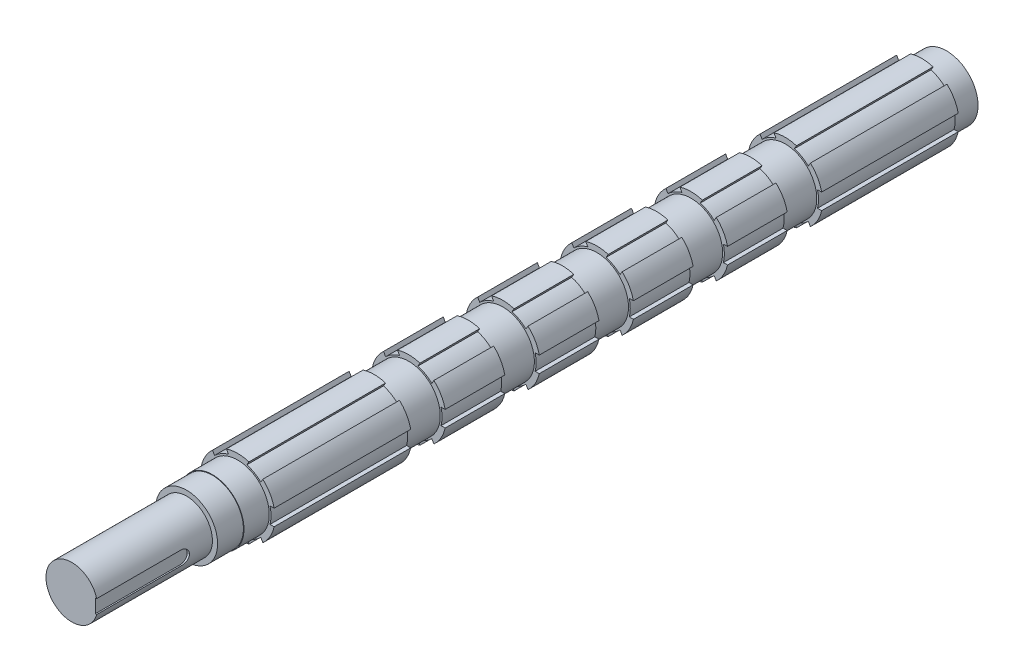
from build123d import *

# Parameters (mm, degrees)
SKETCH1_R           = 32.5
BOSS_EXTRUDE1_DEPTH = 762
SKETCH2_W           = 5
SKETCH2_H           = 30
SKETCH2_H_2         = 21.5
CUT_EXTRUDE1_DEPTH  = 762
CIRPATTERN1_COUNT   = 6
CUT_EXTRUDE2_START  = -80
CUT_EXTRUDE2_DEPTH  = 80
FILLET1_R           = 6


with BuildPart() as part:
    # Sketch1 → Boss-Extrude1 (new body)
    with BuildSketch(Plane.XY):
        Circle(SKETCH1_R)
    extrude(amount=BOSS_EXTRUDE1_DEPTH)

    # Sketch2 → Cut-Revolve1 (revolve, cut)
    with BuildSketch(Plane(origin=(0, 0, 0), x_dir=(1, 0, 0), z_dir=(0, 1, 0)), mode=Mode.PRIVATE) as cut_revolve1_sk:
        Polygon((32.5, -762), (22.5, -762), (22.5, -662), (27, -662), (27, -639.5), (27.5, -639.5), (27.5, -617.5), (32.5, -617.5), (32.5, -639.5), (32.5, -662), align=None)
        with Locations((30, -483.5)):
            Rectangle(SKETCH2_W, SKETCH2_H)
        with Locations((30, -401.5)):
            Rectangle(SKETCH2_W, SKETCH2_H)
        with Locations((30, -319.5)):
            Rectangle(SKETCH2_W, SKETCH2_H)
        with Locations((30, -237.5)):
            Rectangle(SKETCH2_W, SKETCH2_H)
        with Locations((30, -155.5)):
            Rectangle(SKETCH2_W, SKETCH2_H)
        with Locations((30, -10.75)):
            Rectangle(SKETCH2_W, SKETCH2_H_2)
    revolve(cut_revolve1_sk.sketch.rotate(Axis((0, 0, 0), (0, 0, 1)), 180), axis=Axis((0, 0, 0), (0, 0, 1)), mode=Mode.SUBTRACT)

    # Sketch3 → Cut-Extrude1 (cut)
    with BuildSketch(Plane(origin=(0, 0, 0), x_dir=(-1, 0, 0), z_dir=(0, 0, -1))):
        with BuildLine():
            Line((31.737202145, 7), (28.142494559, 7))
            ThreePointArc((28.142494559, 7), (29, 0), (28.142494559, -7))
            Line((28.142494559, -7), (31.737202145, -7))
            ThreePointArc((31.737202145, -7), (32.5, 0), (31.737202145, 7))
        make_face()
    cut_extrude1 = extrude(amount=-CUT_EXTRUDE1_DEPTH, mode=Mode.SUBTRACT)

    # CirPattern1: Cut-Extrude1 ×6 about axis
    cirpattern1_axis = Axis((0, 0, 0), (0, 0, 1))
    for i in range(1, CIRPATTERN1_COUNT):
        add(cut_extrude1.rotate(cirpattern1_axis, i * 360 / CIRPATTERN1_COUNT), mode=Mode.SUBTRACT)

    # Sketch4 → Cut-Extrude2 (cut)
    with BuildSketch(Plane.XY.offset(762).offset(CUT_EXTRUDE2_START)):
        with BuildLine():
            Line((20.5, 6), (20.5, -6))
            Line((20.5, -6), (21.685248442, -6))
            ThreePointArc((21.685248442, -6), (22.5, 0), (21.685248442, 6))
            Line((21.685248442, 6), (20.5, 6))
        make_face()
    extrude(amount=CUT_EXTRUDE2_DEPTH, mode=Mode.SUBTRACT)

    # Fillet1
    # the kernel refuses this fillet: 6 mm, written as the material it adds along each edge
    with BuildSketch(Plane(origin=(36.685248442, 6, 682), x_dir=(0, 0, 1), z_dir=(-1, 0, 0))) as fillet1_piece_1_section:
        with BuildLine():
            CenterArc((FILLET1_R, -FILLET1_R), FILLET1_R, 90, 90)
            Line((0, -FILLET1_R), (0, 0))
            Line((0, 0), (FILLET1_R, 0))
        make_face()
    fillet1_piece_1 = extrude(amount=31.185248442, mode=Mode.PRIVATE)
    fillet1_piece_1 = fillet1_piece_1 & Plane(origin=(0, 0, 683.229591958), x_dir=(-1, 0, 0), z_dir=(0, 0, -1)) * Cylinder(22.5, 87, mode=Mode.PRIVATE)
    add(fillet1_piece_1)
    with BuildSketch(Plane(origin=(5.5, -6, 682), x_dir=(0, 1, 0), z_dir=(1, 0, 0))) as fillet1_piece_2_section:
        with BuildLine():
            CenterArc((FILLET1_R, FILLET1_R), FILLET1_R, 180, 90)
            Line((0, FILLET1_R), (0, 0))
            Line((0, 0), (FILLET1_R, 0))
        make_face()
    fillet1_piece_2 = extrude(amount=31.185248442, mode=Mode.PRIVATE)
    fillet1_piece_2 = fillet1_piece_2 & Plane(origin=(0, 0, 683.358370686), x_dir=(-1, 0, 0), z_dir=(0, 0, -1)) * Cylinder(22.5, 87, mode=Mode.PRIVATE)
    add(fillet1_piece_2)


solid = part.part
